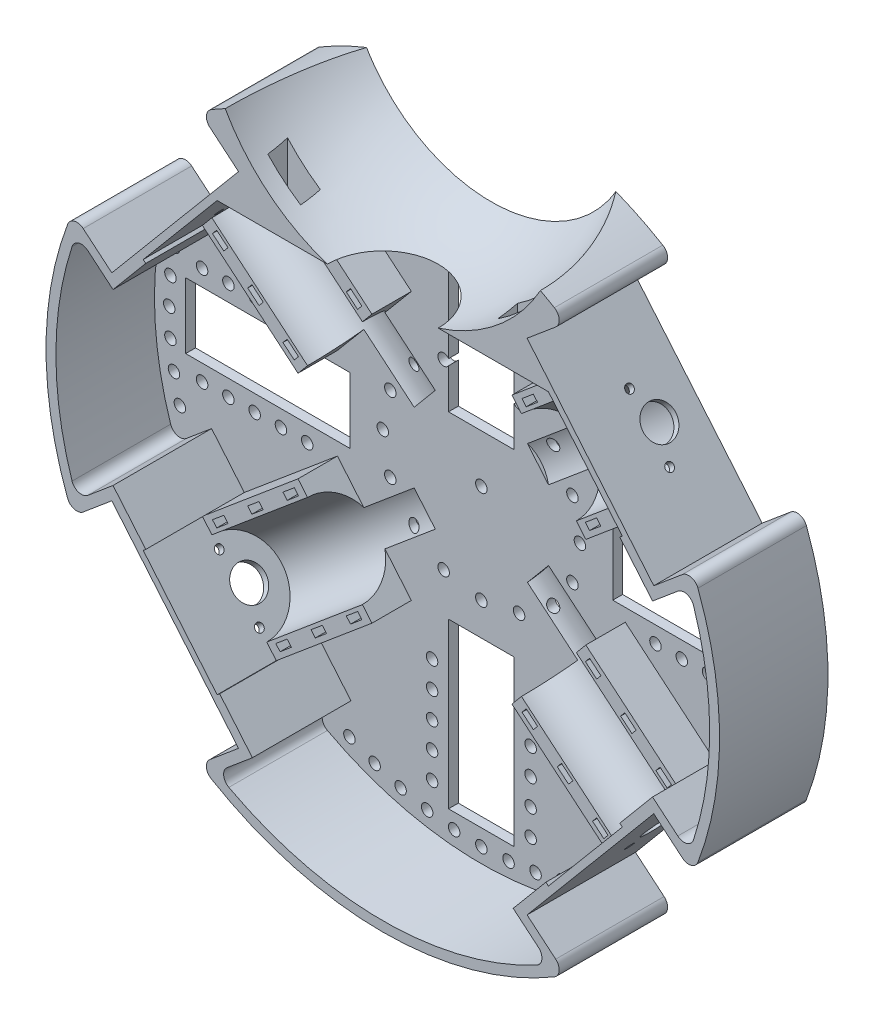
from build123d import *

# Parameters (mm, degrees)
SKETCH1_R                                    = 102.5
BOSS_EXTRUDE1_DEPTH                          = 3
CUT_EXTRUDE1_DEPTH                           = 3
BOSS_EXTRUDE2_DEPTH                          = 12
SKETCH4_R                                    = 13
CUT_EXTRUDE2_DEPTH                           = 60
CUT_EXTRUDE3_DEPTH                           = 146.730916418
BOSS_EXTRUDE3_START                          = -3
BOSS_EXTRUDE3_DEPTH                          = 33
SKETCH7_R                                    = 5
SKETCH7_R_2                                  = 1.25
CUT_EXTRUDE4_DEPTH                           = 2
CUT_EXTRUDE13_DEPTH                          = 1.5
MIRROR1_AT_THE_SECOND_PLANE_COPY_1_DEPTH     = 3
MIRROR1_AT_THE_SECOND_PLANE_COPY_2_DEPTH     = 12
MIRROR1_AT_THE_SECOND_PLANE_COPY_3_SKETC_R   = 13
MIRROR1_AT_THE_SECOND_PLANE_COPY_3_DEPTH     = 60
MIRROR1_AT_THE_SECOND_PLANE_COPY_4_DEPTH     = 146.730916418
MIRROR1_START                                = -3
MIRROR1_AT_THE_SECOND_PLANE_COPY_5_DEPTH     = 33
MIRROR1_AT_THE_SECOND_PLANE_COPY_6_SKETC_R   = 5
MIRROR1_AT_THE_SECOND_PLANE_COPY_6_SKETC_R_2 = 1.25
MIRROR1_AT_THE_SECOND_PLANE_COPY_6_DEPTH     = 2
MIRROR1_AT_THE_SECOND_PLANE_COPY_7_DEPTH     = 1.5
CHAMFER2_SIZE                                = 3
BOSS_EXTRUDE4_DEPTH                          = 30
BOSS_EXTRUDE6_DEPTH                          = 30
FILLET1_R                                    = 3
CUT_EXTRUDE6_DEPTH                           = 149.028713451
CUT_EXTRUDE6_DEPTH_BACK                      = 149.028713451
SKETCH13_R                                   = 1.75
CUT_EXTRUDE7_DEPTH                           = 149.028713451
CUT_EXTRUDE7_DEPTH_BACK                      = 149.028713451
SKETCH14_W                                   = 50
SKETCH14_H                                   = 20
SKETCH14_W_2                                 = 20
SKETCH14_H_2                                 = 50
SKETCH15_R                                   = 1.75
CUT_EXTRUDE8_DEPTH                           = 149.028713451
CIRPATTERN1_COUNT                            = 4
CIRPATTERN1_ANGLE                            = 15
CIRPATTERN1_THE_OTHER_WAY_COUNT              = 4
CIRPATTERN1_THE_OTHER_WAY_ANGLE              = 15
MIRROR2_COPY_1_SKETCH_R                      = 1.75
MIRROR2_COPY_1_DEPTH                         = 149.028713451
MIRROR2_COPY_2_SKETCH_R                      = 1.75
MIRROR2_COPY_2_DEPTH                         = 149.028713451
MIRROR2_COPY_3_SKETCH_R                      = 1.75
MIRROR2_COPY_3_DEPTH                         = 149.028713451
MIRROR2_COPY_4_SKETCH_R                      = 1.75
MIRROR2_COPY_4_DEPTH                         = 149.028713451
MIRROR2_COPY_5_SKETCH_R                      = 1.75
MIRROR2_COPY_5_DEPTH                         = 149.028713451
MIRROR2_COPY_6_SKETCH_R                      = 1.75
MIRROR2_COPY_6_DEPTH                         = 149.028713451
SKETCH16_R                                   = 1.75
CUT_EXTRUDE9_DEPTH                           = 149.028713451
CIRPATTERN2_COUNT                            = 6
CIRPATTERN2_ANGLE                            = 25
CIRPATTERN2_THE_OTHER_WAY_COUNT              = 6
CIRPATTERN2_THE_OTHER_WAY_ANGLE              = 25
SKETCH17_W                                   = 20
SKETCH17_H                                   = 50
CUT_EXTRUDE10_DEPTH                          = 149.028713451
SKETCH18_R                                   = 1.75
CUT_EXTRUDE11_DEPTH                          = 149.028713451
LPATTERN1_COUNT                              = 5
LPATTERN1_PITCH                              = 8
CIRPATTERN3_COUNT                            = 3
CIRPATTERN3_ANGLE                            = 180
CIRPATTERN3_COPY_1_SKETCH_R                  = 1.75
CIRPATTERN3_COPY_1_DEPTH                     = 149.028713451
CIRPATTERN3_COPY_2_SKETCH_R                  = 1.75
CIRPATTERN3_COPY_2_DEPTH                     = 149.028713451
CIRPATTERN3_COPY_3_SKETCH_R                  = 1.75
CIRPATTERN3_COPY_3_DEPTH                     = 149.028713451
CIRPATTERN3_COPY_4_SKETCH_R                  = 1.75
CIRPATTERN3_COPY_4_DEPTH                     = 149.028713451
CIRPATTERN3_COPY_5_SKETCH_R                  = 1.75
CIRPATTERN3_COPY_5_DEPTH                     = 149.028713451
CIRPATTERN3_COPY_6_SKETCH_R                  = 1.75
CIRPATTERN3_COPY_6_DEPTH                     = 149.028713451
CIRPATTERN3_COPY_7_SKETCH_R                  = 1.75
CIRPATTERN3_COPY_7_DEPTH                     = 149.028713451
CIRPATTERN3_COPY_8_SKETCH_R                  = 1.75
CIRPATTERN3_COPY_8_DEPTH                     = 149.028713451
SKETCH21_W                                   = 10
SKETCH21_H                                   = 6
CUT_EXTRUDE14_DEPTH                          = 200.253188112


with BuildPart() as part:
    # Sketch1 → Boss-Extrude1 (new body)
    with BuildSketch(Plane.XY):
        Circle(SKETCH1_R)
    extrude(amount=BOSS_EXTRUDE1_DEPTH)

    # Sketch2 → Cut-Extrude1 (cut)
    with BuildSketch(Plane.XY.offset(3)):
        Polygon((74.556815991, 101.72281548), (113.124072573, 55.760148893), (82.482294848, 30.048644506), (43.915038267, 76.011311093), align=None)
    cut_extrude1 = extrude(amount=-CUT_EXTRUDE1_DEPTH, mode=Mode.SUBTRACT)

    # Sketch3 → Boss-Extrude2 (add)
    with BuildSketch(Plane.XY.offset(3)):
        Polygon((51.949883388, 66.435755554), (74.447449727, 39.624200045), (43.805672002, 13.912695657), (21.308105663, 40.724251166), align=None)
    boss_extrude2 = extrude(amount=BOSS_EXTRUDE2_DEPTH)

    # Sketch4 → Cut-Extrude2 (cut)
    with BuildSketch(Plane(origin=(63.198666557, 53.029977799, 0), x_dir=(0, 0, -1), z_dir=(0.7660444431189809, 0.6427876096865359, 0))):
        with Locations((-15, 0)):
            Circle(SKETCH4_R)
    cut_extrude2 = extrude(amount=-CUT_EXTRUDE2_DEPTH, mode=Mode.SUBTRACT)

    # Sketch5 → Cut-Extrude3 (cut, through all)
    with BuildSketch(Plane.XY.offset(15)):
        Polygon((68.558981988, 39.252114449), (65.111781994, 36.359570206), (66.397357213, 34.82748132), (69.844557207, 37.720025563), align=None)
        Polygon((57.834359784, 30.253087914), (54.38715979, 27.36054367), (55.67273501, 25.828454784), (59.119935004, 28.720999028), align=None)
        Polygon((43.662537587, 18.361517135), (47.109737581, 21.254061378), (48.3953128, 19.721972492), (44.948112806, 16.829428248), align=None)
        Polygon((50.560928917, 60.701358857), (47.113728923, 57.808814613), (45.828153703, 59.340903499), (49.275353698, 62.233447743), align=None)
        Polygon((35.1035315, 50.341876964), (38.550731494, 53.234421207), (39.836306713, 51.702332321), (36.389106719, 48.809788078), align=None)
        Polygon((25.664484516, 39.810761542), (29.11168451, 42.703305786), (27.82610929, 44.235394672), (24.378909296, 41.342850428), align=None)
    cut_extrude3 = extrude(amount=-CUT_EXTRUDE3_DEPTH, mode=Mode.SUBTRACT)

    # Sketch6 → Boss-Extrude3 (add)
    with BuildSketch(Plane.XY.offset(3).offset(BOSS_EXTRUDE3_START)):
        Polygon((51.949883388, 66.435755554), (74.447449727, 39.624200045), (72.915360841, 38.338624825), (50.417794502, 65.150180334), align=None)
    boss_extrude3 = extrude(amount=BOSS_EXTRUDE3_DEPTH)

    # Sketch7 → Cut-Extrude4 (cut)
    with BuildSketch(Plane(origin=(63.198666557, 53.029977799, 0), x_dir=(0, 0, -1), z_dir=(0.7660444431189809, 0.6427876096865359, 0))):
        with Locations(Location((-12, 0, 0), (0, 0, 90))):
            Circle(SKETCH7_R)
        with Locations(Location((-15, 9.5, 0), (0, 0, 90))):
            Circle(SKETCH7_R_2)
        with Locations(Location((-15, -9.5, 0), (0, 0, 90))):
            Circle(SKETCH7_R_2)
    cut_extrude4 = extrude(amount=-CUT_EXTRUDE4_DEPTH, mode=Mode.SUBTRACT)

    # Sketch20 → Cut-Extrude13 (cut)
    with BuildSketch(Plane(origin=(0, 0, 0), x_dir=(-1, 0, 0), z_dir=(0, 0, -1))):
        Polygon((-68.558981988, 39.252114449), (-50.560928917, 60.701358857), (-47.113728923, 57.808814613), (-65.111781994, 36.359570206), align=None)
        Polygon((-57.834359784, 30.253087914), (-39.836306713, 51.702332321), (-36.389106719, 48.809788078), (-54.38715979, 27.36054367), align=None)
        Polygon((-29.11168451, 42.703305786), (-47.109737581, 21.254061378), (-43.662537587, 18.361517135), (-25.664484516, 39.810761542), align=None)
    cut_extrude13 = extrude(amount=-CUT_EXTRUDE13_DEPTH, mode=Mode.SUBTRACT)

    # Mirror1: Cut-Extrude1, Boss-Extrude2, Cut-Extrude2, Cut-Extrude3, Boss-Extrude3, Cut-Extrude4, Cut-Extrude13 across plane
    add(cut_extrude1.mirror(Plane(origin=(0, 0, 0), x_dir=(0, 0, 1), z_dir=(1, 0, 0))), mode=Mode.SUBTRACT)
    add(boss_extrude2.mirror(Plane(origin=(0, 0, 0), x_dir=(0, 0, 1), z_dir=(1, 0, 0))))
    add(cut_extrude2.mirror(Plane(origin=(0, 0, 0), x_dir=(0, 0, 1), z_dir=(1, 0, 0))), mode=Mode.SUBTRACT)
    add(cut_extrude3.mirror(Plane(origin=(0, 0, 0), x_dir=(0, 0, 1), z_dir=(1, 0, 0))), mode=Mode.SUBTRACT)
    add(boss_extrude3.mirror(Plane(origin=(0, 0, 0), x_dir=(0, 0, 1), z_dir=(1, 0, 0))))
    add(cut_extrude4.mirror(Plane(origin=(0, 0, 0), x_dir=(0, 0, 1), z_dir=(1, 0, 0))), mode=Mode.SUBTRACT)
    add(cut_extrude13.mirror(Plane(origin=(0, 0, 0), x_dir=(0, 0, 1), z_dir=(1, 0, 0))), mode=Mode.SUBTRACT)

    # Mirror1 at the second plane: Cut-Extrude1, Boss-Extrude2, Cut-Extrude2, Cut-Extrude3, Boss-Extrude3, Cut-Extrude4, Cut-Extrude13 across plane
    add(cut_extrude1.mirror(Plane.ZX), mode=Mode.SUBTRACT)
    add(boss_extrude2.mirror(Plane.ZX))
    add(cut_extrude2.mirror(Plane.ZX), mode=Mode.SUBTRACT)
    add(cut_extrude3.mirror(Plane.ZX), mode=Mode.SUBTRACT)
    add(boss_extrude3.mirror(Plane.ZX))
    add(cut_extrude4.mirror(Plane.ZX), mode=Mode.SUBTRACT)
    add(cut_extrude13.mirror(Plane.ZX), mode=Mode.SUBTRACT)

    # Mirror1 at the second plane copy 1 sketc → Mirror1 at the second plane copy 1 (cut)
    with BuildSketch(Plane(origin=(0, 0, 3), x_dir=(-1, 0, 0), z_dir=(0, 0, 1))):
        Polygon((74.556815991, 101.72281548), (113.124072573, 55.760148893), (82.482294848, 30.048644506), (43.915038267, 76.011311093), align=None)
    extrude(amount=-MIRROR1_AT_THE_SECOND_PLANE_COPY_1_DEPTH, mode=Mode.SUBTRACT)

    # Mirror1 at the second plane copy 2 sketc → Mirror1 at the second plane copy 2 (add)
    with BuildSketch(Plane(origin=(0, 0, 3), x_dir=(-1, 0, 0), z_dir=(0, 0, 1))):
        Polygon((51.949883388, 66.435755554), (74.447449727, 39.624200045), (43.805672002, 13.912695657), (21.308105663, 40.724251166), align=None)
    extrude(amount=MIRROR1_AT_THE_SECOND_PLANE_COPY_2_DEPTH)

    # Mirror1 at the second plane copy 3 sketc → Mirror1 at the second plane copy 3 (cut)
    with BuildSketch(Plane(origin=(-63.198666557, -53.029977799, 0), x_dir=(0, 0, -1), z_dir=(-0.7660444431189809, -0.6427876096865359, 0))):
        with Locations((-15, 0)):
            Circle(MIRROR1_AT_THE_SECOND_PLANE_COPY_3_SKETC_R)
    extrude(amount=-MIRROR1_AT_THE_SECOND_PLANE_COPY_3_DEPTH, mode=Mode.SUBTRACT)

    # Mirror1 at the second plane copy 4 sketc → Mirror1 at the second plane copy 4 (cut, through all)
    with BuildSketch(Plane(origin=(0, 0, 15), x_dir=(-1, 0, 0), z_dir=(0, 0, 1))):
        Polygon((68.558981988, 39.252114449), (65.111781994, 36.359570206), (66.397357213, 34.82748132), (69.844557207, 37.720025563), align=None)
        Polygon((57.834359784, 30.253087914), (54.38715979, 27.36054367), (55.67273501, 25.828454784), (59.119935004, 28.720999028), align=None)
        Polygon((43.662537587, 18.361517135), (47.109737581, 21.254061378), (48.3953128, 19.721972492), (44.948112806, 16.829428248), align=None)
        Polygon((50.560928917, 60.701358857), (47.113728923, 57.808814613), (45.828153703, 59.340903499), (49.275353698, 62.233447743), align=None)
        Polygon((35.1035315, 50.341876964), (38.550731494, 53.234421207), (39.836306713, 51.702332321), (36.389106719, 48.809788078), align=None)
        Polygon((25.664484516, 39.810761542), (29.11168451, 42.703305786), (27.82610929, 44.235394672), (24.378909296, 41.342850428), align=None)
    extrude(amount=-MIRROR1_AT_THE_SECOND_PLANE_COPY_4_DEPTH, mode=Mode.SUBTRACT)

    # Mirror1 at the second plane copy 5 sketc → Mirror1 at the second plane copy 5 (add)
    with BuildSketch(Plane(origin=(0, 0, 3), x_dir=(-1, 0, 0), z_dir=(0, 0, 1)).offset(MIRROR1_START)):
        Polygon((51.949883388, 66.435755554), (74.447449727, 39.624200045), (72.915360841, 38.338624825), (50.417794502, 65.150180334), align=None)
    extrude(amount=MIRROR1_AT_THE_SECOND_PLANE_COPY_5_DEPTH)

    # Mirror1 at the second plane copy 6 sketc → Mirror1 at the second plane copy 6 (cut)
    with BuildSketch(Plane(origin=(-63.198666557, -53.029977799, 0), x_dir=(0, 0, -1), z_dir=(-0.7660444431189809, -0.6427876096865359, 0))):
        with Locations(Location((-12, 0, 0), (0, 0, 90))):
            Circle(MIRROR1_AT_THE_SECOND_PLANE_COPY_6_SKETC_R)
        with Locations(Location((-15, 9.5, 0), (0, 0, 90))):
            Circle(MIRROR1_AT_THE_SECOND_PLANE_COPY_6_SKETC_R_2)
        with Locations(Location((-15, -9.5, 0), (0, 0, 90))):
            Circle(MIRROR1_AT_THE_SECOND_PLANE_COPY_6_SKETC_R_2)
    extrude(amount=-MIRROR1_AT_THE_SECOND_PLANE_COPY_6_DEPTH, mode=Mode.SUBTRACT)

    # Mirror1 at the second plane copy 7 sketc → Mirror1 at the second plane copy 7 (cut)
    with BuildSketch(Plane(origin=(0, 0, 0), x_dir=(1, 0, 0), z_dir=(0, 0, -1))):
        Polygon((-68.558981988, 39.252114449), (-50.560928917, 60.701358857), (-47.113728923, 57.808814613), (-65.111781994, 36.359570206), align=None)
        Polygon((-57.834359784, 30.253087914), (-39.836306713, 51.702332321), (-36.389106719, 48.809788078), (-54.38715979, 27.36054367), align=None)
        Polygon((-29.11168451, 42.703305786), (-47.109737581, 21.254061378), (-43.662537587, 18.361517135), (-25.664484516, 39.810761542), align=None)
    extrude(amount=-MIRROR1_AT_THE_SECOND_PLANE_COPY_7_DEPTH, mode=Mode.SUBTRACT)

    # Chamfer2
    chamfer2_edges = [part.edges().sort_by_distance(p)[0] for p in [
        (56.110759787, 28.806815792, 1.5),
        (38.112706716, 50.256060199, 1.5),
        (27.388084513, 41.257033664, 1.5),
        (45.386137584, 19.807789256, 1.5),
        (66.835381991, 37.805842328, 1.5),
        (48.83732892, 59.255086735, 1.5),
        (56.110759787, -28.806815792, 1.5),
        (38.112706716, -50.256060199, 1.5),
        (27.388084513, -41.257033664, 1.5),
        (45.386137584, -19.807789256, 1.5),
        (66.835381991, -37.805842328, 1.5),
        (48.83732892, -59.255086735, 1.5),
        (-56.110759787, 28.806815792, 1.5),
        (-38.112706716, 50.256060199, 1.5),
        (-27.388084513, 41.257033664, 1.5),
        (-45.386137584, 19.807789256, 1.5),
        (-66.835381991, 37.805842328, 1.5),
        (-48.83732892, 59.255086735, 1.5),
        (-56.110759787, -28.806815792, 1.5),
        (-38.112706716, -50.256060199, 1.5),
        (-27.388084513, -41.257033664, 1.5),
        (-45.386137584, -19.807789256, 1.5),
        (-66.835381991, -37.805842328, 1.5),
        (-48.83732892, -59.255086735, 1.5),
    ]]
    chamfer(chamfer2_edges, length=CHAMFER2_SIZE)

    # Sketch8 → Boss-Extrude4 (add)
    with BuildSketch(Plane.XY.offset(3)):
        with BuildLine():
            Line((74.447449727, 39.624200045), (82.482294848, 30.048644506))
            Line((82.482294848, 30.048644506), (94.364777079, 40.019230963))
            ThreePointArc((94.364777079, 40.019230963), (102.5, 0), (94.364777079, -40.019230963))
            Line((94.364777079, -40.019230963), (82.482294848, -30.048644506))
            Line((82.482294848, -30.048644506), (74.447449727, -39.624200045))
            Line((74.447449727, -39.624200045), (72.149316397, -37.695837215))
            Line((72.149316397, -37.695837215), (82.112524348, -25.822148347))
            Line((82.112524348, -25.822148347), (93.119249117, -35.057887042))
            ThreePointArc((93.119249117, -35.057887042), (99.5, 0), (93.119249117, 35.057887042))
            Line((93.119249117, 35.057887042), (82.112524348, 25.822148347))
            Line((82.112524348, 25.822148347), (72.149316397, 37.695837215))
            Line((72.149316397, 37.695837215), (74.447449727, 39.624200045))
        make_face()
        with BuildLine():
            Line((43.915038267, -76.011311093), (51.949883388, -66.435755554))
            Line((51.949883388, -66.435755554), (49.651750058, -64.507392725))
            Line((49.651750058, -64.507392725), (39.688542108, -76.381081593))
            Line((39.688542108, -76.381081593), (50.695266878, -85.616820288))
            ThreePointArc((50.695266878, -85.616820288), (0, -99.5), (-50.695266878, -85.616820288))
            Line((-50.695266878, -85.616820288), (-39.688542108, -76.381081593))
            Line((-39.688542108, -76.381081593), (-49.651750058, -64.507392725))
            Line((-49.651750058, -64.507392725), (-51.949883388, -66.435755554))
            Line((-51.949883388, -66.435755554), (-43.915038267, -76.011311093))
            Line((-43.915038267, -76.011311093), (-55.797520498, -85.98189755))
            ThreePointArc((-55.797520498, -85.98189755), (0, -102.5), (55.797520498, -85.98189755))
            Line((55.797520498, -85.98189755), (43.915038267, -76.011311093))
        make_face()
        with BuildLine():
            Line((-74.447449727, 39.624200045), (-82.482294848, 30.048644506))
            Line((-82.482294848, 30.048644506), (-94.364777079, 40.019230963))
            ThreePointArc((-94.364777079, 40.019230963), (-102.5, 0), (-94.364777079, -40.019230963))
            Line((-94.364777079, -40.019230963), (-82.482294848, -30.048644506))
            Line((-82.482294848, -30.048644506), (-74.447449727, -39.624200045))
            Line((-74.447449727, -39.624200045), (-72.149316397, -37.695837215))
            Line((-72.149316397, -37.695837215), (-82.112524348, -25.822148347))
            Line((-82.112524348, -25.822148347), (-93.119249117, -35.057887042))
            ThreePointArc((-93.119249117, -35.057887042), (-99.5, 0), (-93.119249117, 35.057887042))
            Line((-93.119249117, 35.057887042), (-82.112524348, 25.822148347))
            Line((-82.112524348, 25.822148347), (-72.149316397, 37.695837215))
            Line((-72.149316397, 37.695837215), (-74.447449727, 39.624200045))
        make_face()
    extrude(amount=BOSS_EXTRUDE4_DEPTH)

    # Sketch9 → Boss-Extrude6 (add)
    with BuildSketch(Plane.XY.offset(3)):
        with BuildLine():
            Line((43.915038267, 76.011311093), (51.949883388, 66.435755554))
            Line((51.949883388, 66.435755554), (50.417794502, 65.150180334))
            Line((50.417794502, 65.150180334), (-50.417794502, 65.150180334))
            Line((-50.417794502, 65.150180334), (-51.949883388, 66.435755554))
            Line((-51.949883388, 66.435755554), (-43.915038267, 76.011311093))
            Line((-43.915038267, 76.011311093), (-55.797520498, 85.98189755))
            ThreePointArc((-55.797520498, 85.98189755), (0, 102.5), (55.797520498, 85.98189755))
            Line((55.797520498, 85.98189755), (43.915038267, 76.011311093))
        make_face()
    extrude(amount=BOSS_EXTRUDE6_DEPTH)

    # Sketch10 → Cut-Revolve1 (revolve, cut)
    with BuildSketch(Plane.XY.offset(33)):
        with BuildLine():
            Line((-55, 117.5), (55, 117.5))
            ThreePointArc((55, 117.5), (0, 62.5), (-55, 117.5))
        make_face()
    revolve(axis=Axis((-55, 117.5, 33), (1, 0, 0)), mode=Mode.SUBTRACT)

    # Fillet1
    fillet1_edges = [part.edges().sort_by_distance(p)[0] for p in [
        (93.119249117, 35.057887042, 18),
        (93.119249117, -35.057887042, 18),
        (50.695266878, -85.616820288, 18),
        (-50.695266878, -85.616820288, 18),
        (55.797520498, 85.98189755, 16.5),
        (-93.119249117, -35.057887042, 18),
        (-93.119249117, 35.057887042, 18),
        (94.364777079, 40.019230963, 16.5),
        (55.797520498, -85.98189755, 18),
        (94.364777079, -40.019230963, 16.5),
        (-55.797520498, 85.98189755, 16.5),
        (-94.364777079, 40.019230963, 16.5),
        (-55.797520498, -85.98189755, 18),
        (-94.364777079, -40.019230963, 16.5),
    ]]
    fillet(fillet1_edges, radius=FILLET1_R)

    # Sketch13 → Cut-Extrude6 (cut, two sides: drawn at the far end of the back side and taken through both)
    with BuildSketch(Plane.XY.offset(3).offset(-CUT_EXTRUDE6_DEPTH_BACK)):
        with Locations((-30, 0)):
            Circle(SKETCH13_R)
        with Locations((-27.716385975, 11.480502971)):
            Circle(SKETCH13_R)
        with Locations((-21.213203436, 21.213203436)):
            Circle(SKETCH13_R)
        with Locations((-11.480502971, 27.716385975)):
            Circle(SKETCH13_R)
        with Locations((0, 30)):
            Circle(SKETCH13_R)
        with Locations((11.480502971, 27.716385975)):
            Circle(SKETCH13_R)
        with Locations((21.213203436, 21.213203436)):
            Circle(SKETCH13_R)
        with Locations((27.716385975, 11.480502971)):
            Circle(SKETCH13_R)
        with Locations((30, 0)):
            Circle(SKETCH13_R)
        with Locations((27.716385975, -11.480502971)):
            Circle(SKETCH13_R)
        with Locations((21.213203436, -21.213203436)):
            Circle(SKETCH13_R)
        with Locations((11.480502971, -27.716385975)):
            Circle(SKETCH13_R)
        with Locations((0, -30)):
            Circle(SKETCH13_R)
        with Locations((-11.480502971, -27.716385975)):
            Circle(SKETCH13_R)
        with Locations((-21.213203436, -21.213203436)):
            Circle(SKETCH13_R)
        with Locations((-27.716385975, -11.480502971)):
            Circle(SKETCH13_R)
        Circle(SKETCH13_R)
    extrude(amount=CUT_EXTRUDE6_DEPTH + CUT_EXTRUDE6_DEPTH_BACK, mode=Mode.SUBTRACT)

    # Sketch14 → Cut-Extrude7 (cut, two sides: drawn at the far end of the back side and taken through both)
    with BuildSketch(Plane.XY.offset(3).offset(-CUT_EXTRUDE7_DEPTH_BACK)):
        with Locations((-65, 0)):
            Rectangle(SKETCH14_W, SKETCH14_H)
        with Locations((65, 0)):
            Rectangle(SKETCH14_W, SKETCH14_H)
        with Locations((0, -65)):
            Rectangle(SKETCH14_W_2, SKETCH14_H_2)
    extrude(amount=CUT_EXTRUDE7_DEPTH + CUT_EXTRUDE7_DEPTH_BACK, mode=Mode.SUBTRACT)

    # Sketch15 → Cut-Extrude8 (cut, through all)
    with BuildSketch(Plane.XY.offset(3)):
        with Locations((-95, 0)):
            Circle(SKETCH15_R)
    cut_extrude8 = extrude(amount=-CUT_EXTRUDE8_DEPTH, mode=Mode.SUBTRACT)

    # CirPattern1: Cut-Extrude8 ×4 about axis
    cirpattern1_axis = Axis((0, 0, 0), (0, 0, -1))
    for i in range(1, CIRPATTERN1_COUNT):
        add(cut_extrude8.rotate(cirpattern1_axis, i * CIRPATTERN1_ANGLE / (CIRPATTERN1_COUNT - 1)), mode=Mode.SUBTRACT)

    # CirPattern1 the other way: Cut-Extrude8 ×4 about axis
    cirpattern1_the_other_way_axis = Axis((0, 0, 0), (0, 0, 1))
    for i in range(1, CIRPATTERN1_THE_OTHER_WAY_COUNT):
        add(cut_extrude8.rotate(cirpattern1_the_other_way_axis, i * CIRPATTERN1_THE_OTHER_WAY_ANGLE / (CIRPATTERN1_THE_OTHER_WAY_COUNT - 1)), mode=Mode.SUBTRACT)

    # Mirror2: Cut-Extrude8 across plane
    add(cut_extrude8.mirror(Plane(origin=(0, 0, 0), x_dir=(0, 0, 1), z_dir=(1, 0, 0))), mode=Mode.SUBTRACT)

    # Mirror2 copy 1 sketch → Mirror2 copy 1 (cut, through all)
    with BuildSketch(Plane(origin=(0, 0, 3), x_dir=(-0.9961946980917455, -0.08715574274765837, 0), z_dir=(0, 0, 1))):
        with Locations((-95, 0)):
            Circle(MIRROR2_COPY_1_SKETCH_R)
    extrude(amount=-MIRROR2_COPY_1_DEPTH, mode=Mode.SUBTRACT)

    # Mirror2 copy 2 sketch → Mirror2 copy 2 (cut, through all)
    with BuildSketch(Plane(origin=(0, 0, 3), x_dir=(-0.984807753012208, -0.17364817766693075, 0), z_dir=(0, 0, 1))):
        with Locations((-95, 0)):
            Circle(MIRROR2_COPY_2_SKETCH_R)
    extrude(amount=-MIRROR2_COPY_2_DEPTH, mode=Mode.SUBTRACT)

    # Mirror2 copy 3 sketch → Mirror2 copy 3 (cut, through all)
    with BuildSketch(Plane(origin=(0, 0, 3), x_dir=(-0.9659258262890681, -0.2588190451025214, 0), z_dir=(0, 0, 1))):
        with Locations((-95, 0)):
            Circle(MIRROR2_COPY_3_SKETCH_R)
    extrude(amount=-MIRROR2_COPY_3_DEPTH, mode=Mode.SUBTRACT)

    # Mirror2 copy 4 sketch → Mirror2 copy 4 (cut, through all)
    with BuildSketch(Plane(origin=(0, 0, 3), x_dir=(-0.9961946980917455, 0.08715574274765837, 0), z_dir=(0, 0, 1))):
        with Locations((-95, 0)):
            Circle(MIRROR2_COPY_4_SKETCH_R)
    extrude(amount=-MIRROR2_COPY_4_DEPTH, mode=Mode.SUBTRACT)

    # Mirror2 copy 5 sketch → Mirror2 copy 5 (cut, through all)
    with BuildSketch(Plane(origin=(0, 0, 3), x_dir=(-0.984807753012208, 0.17364817766693075, 0), z_dir=(0, 0, 1))):
        with Locations((-95, 0)):
            Circle(MIRROR2_COPY_5_SKETCH_R)
    extrude(amount=-MIRROR2_COPY_5_DEPTH, mode=Mode.SUBTRACT)

    # Mirror2 copy 6 sketch → Mirror2 copy 6 (cut, through all)
    with BuildSketch(Plane(origin=(0, 0, 3), x_dir=(-0.9659258262890681, 0.2588190451025214, 0), z_dir=(0, 0, 1))):
        with Locations((-95, 0)):
            Circle(MIRROR2_COPY_6_SKETCH_R)
    extrude(amount=-MIRROR2_COPY_6_DEPTH, mode=Mode.SUBTRACT)

    # Sketch16 → Cut-Extrude9 (cut, through all)
    with BuildSketch(Plane.XY.offset(3)):
        with Locations((0, -95)):
            Circle(SKETCH16_R)
    cut_extrude9 = extrude(amount=-CUT_EXTRUDE9_DEPTH, mode=Mode.SUBTRACT)

    # CirPattern2: Cut-Extrude9 ×6 about axis
    cirpattern2_axis = Axis((0, 0, 0), (0, 0, -1))
    for i in range(1, CIRPATTERN2_COUNT):
        add(cut_extrude9.rotate(cirpattern2_axis, i * CIRPATTERN2_ANGLE / (CIRPATTERN2_COUNT - 1)), mode=Mode.SUBTRACT)

    # CirPattern2 the other way: Cut-Extrude9 ×6 about axis
    cirpattern2_the_other_way_axis = Axis((0, 0, 0), (0, 0, 1))
    for i in range(1, CIRPATTERN2_THE_OTHER_WAY_COUNT):
        add(cut_extrude9.rotate(cirpattern2_the_other_way_axis, i * CIRPATTERN2_THE_OTHER_WAY_ANGLE / (CIRPATTERN2_THE_OTHER_WAY_COUNT - 1)), mode=Mode.SUBTRACT)

    # Sketch17 → Cut-Extrude10 (cut, through all)
    with BuildSketch(Plane.XY.offset(3)):
        with Locations((0, 39.650180334)):
            Rectangle(SKETCH17_W, SKETCH17_H)
    extrude(amount=-CUT_EXTRUDE10_DEPTH, mode=Mode.SUBTRACT)

    # Sketch18 → Cut-Extrude11 (cut, symmetric)
    with BuildSketch(Plane.XY.offset(3)):
        with Locations((-85, 15)):
            Circle(SKETCH18_R)
        with Locations((-85, -15)):
            Circle(SKETCH18_R)
    cut_extrude11 = extrude(amount=CUT_EXTRUDE11_DEPTH, both=True, mode=Mode.SUBTRACT)

    # LPattern1: Cut-Extrude11 ×5
    with Locations(*[(i * LPATTERN1_PITCH, 0, 0) for i in range(1, LPATTERN1_COUNT)]):
        add(cut_extrude11, mode=Mode.SUBTRACT)

    # CirPattern3: Cut-Extrude11 ×3 about axis
    cirpattern3_axis = Axis((0, 0, 3), (0, 0, 1))
    for i in range(1, CIRPATTERN3_COUNT):
        add(cut_extrude11.rotate(cirpattern3_axis, i * CIRPATTERN3_ANGLE / (CIRPATTERN3_COUNT - 1)), mode=Mode.SUBTRACT)

    # CirPattern3 copy 1 sketch → CirPattern3 copy 1 (cut, symmetric)
    with BuildSketch(Plane(origin=(0, 8, 3), x_dir=(0, 1, 0), z_dir=(0, 0, 1))):
        with Locations((-85, 15)):
            Circle(CIRPATTERN3_COPY_1_SKETCH_R)
        with Locations((-85, -15)):
            Circle(CIRPATTERN3_COPY_1_SKETCH_R)
    extrude(amount=CIRPATTERN3_COPY_1_DEPTH, both=True, mode=Mode.SUBTRACT)

    # CirPattern3 copy 2 sketch → CirPattern3 copy 2 (cut, symmetric)
    with BuildSketch(Plane(origin=(-8, 0, 3), x_dir=(-1, 0, 0), z_dir=(0, 0, 1))):
        with Locations((-85, 15)):
            Circle(CIRPATTERN3_COPY_2_SKETCH_R)
        with Locations((-85, -15)):
            Circle(CIRPATTERN3_COPY_2_SKETCH_R)
    extrude(amount=CIRPATTERN3_COPY_2_DEPTH, both=True, mode=Mode.SUBTRACT)

    # CirPattern3 copy 3 sketch → CirPattern3 copy 3 (cut, symmetric)
    with BuildSketch(Plane(origin=(0, 16, 3), x_dir=(0, 1, 0), z_dir=(0, 0, 1))):
        with Locations((-85, 15)):
            Circle(CIRPATTERN3_COPY_3_SKETCH_R)
        with Locations((-85, -15)):
            Circle(CIRPATTERN3_COPY_3_SKETCH_R)
    extrude(amount=CIRPATTERN3_COPY_3_DEPTH, both=True, mode=Mode.SUBTRACT)

    # CirPattern3 copy 4 sketch → CirPattern3 copy 4 (cut, symmetric)
    with BuildSketch(Plane(origin=(-16, 0, 3), x_dir=(-1, 0, 0), z_dir=(0, 0, 1))):
        with Locations((-85, 15)):
            Circle(CIRPATTERN3_COPY_4_SKETCH_R)
        with Locations((-85, -15)):
            Circle(CIRPATTERN3_COPY_4_SKETCH_R)
    extrude(amount=CIRPATTERN3_COPY_4_DEPTH, both=True, mode=Mode.SUBTRACT)

    # CirPattern3 copy 5 sketch → CirPattern3 copy 5 (cut, symmetric)
    with BuildSketch(Plane(origin=(0, 24, 3), x_dir=(0, 1, 0), z_dir=(0, 0, 1))):
        with Locations((-85, 15)):
            Circle(CIRPATTERN3_COPY_5_SKETCH_R)
        with Locations((-85, -15)):
            Circle(CIRPATTERN3_COPY_5_SKETCH_R)
    extrude(amount=CIRPATTERN3_COPY_5_DEPTH, both=True, mode=Mode.SUBTRACT)

    # CirPattern3 copy 6 sketch → CirPattern3 copy 6 (cut, symmetric)
    with BuildSketch(Plane(origin=(-24, 0, 3), x_dir=(-1, 0, 0), z_dir=(0, 0, 1))):
        with Locations((-85, 15)):
            Circle(CIRPATTERN3_COPY_6_SKETCH_R)
        with Locations((-85, -15)):
            Circle(CIRPATTERN3_COPY_6_SKETCH_R)
    extrude(amount=CIRPATTERN3_COPY_6_DEPTH, both=True, mode=Mode.SUBTRACT)

    # CirPattern3 copy 7 sketch → CirPattern3 copy 7 (cut, symmetric)
    with BuildSketch(Plane(origin=(0, 32, 3), x_dir=(0, 1, 0), z_dir=(0, 0, 1))):
        with Locations((-85, 15)):
            Circle(CIRPATTERN3_COPY_7_SKETCH_R)
        with Locations((-85, -15)):
            Circle(CIRPATTERN3_COPY_7_SKETCH_R)
    extrude(amount=CIRPATTERN3_COPY_7_DEPTH, both=True, mode=Mode.SUBTRACT)

    # CirPattern3 copy 8 sketch → CirPattern3 copy 8 (cut, symmetric)
    with BuildSketch(Plane(origin=(-32, 0, 3), x_dir=(-1, 0, 0), z_dir=(0, 0, 1))):
        with Locations((-85, 15)):
            Circle(CIRPATTERN3_COPY_8_SKETCH_R)
        with Locations((-85, -15)):
            Circle(CIRPATTERN3_COPY_8_SKETCH_R)
    extrude(amount=CIRPATTERN3_COPY_8_DEPTH, both=True, mode=Mode.SUBTRACT)

    # Sketch21 → Cut-Extrude14 (cut, through all)
    with BuildSketch(Plane.XZ.offset(-65.150180334)):
        with Locations((-35, 25)):
            Rectangle(SKETCH21_W, SKETCH21_H)
        with Locations((35, 25)):
            Rectangle(SKETCH21_W, SKETCH21_H)
    extrude(amount=-CUT_EXTRUDE14_DEPTH, mode=Mode.SUBTRACT)


solid = part.part
